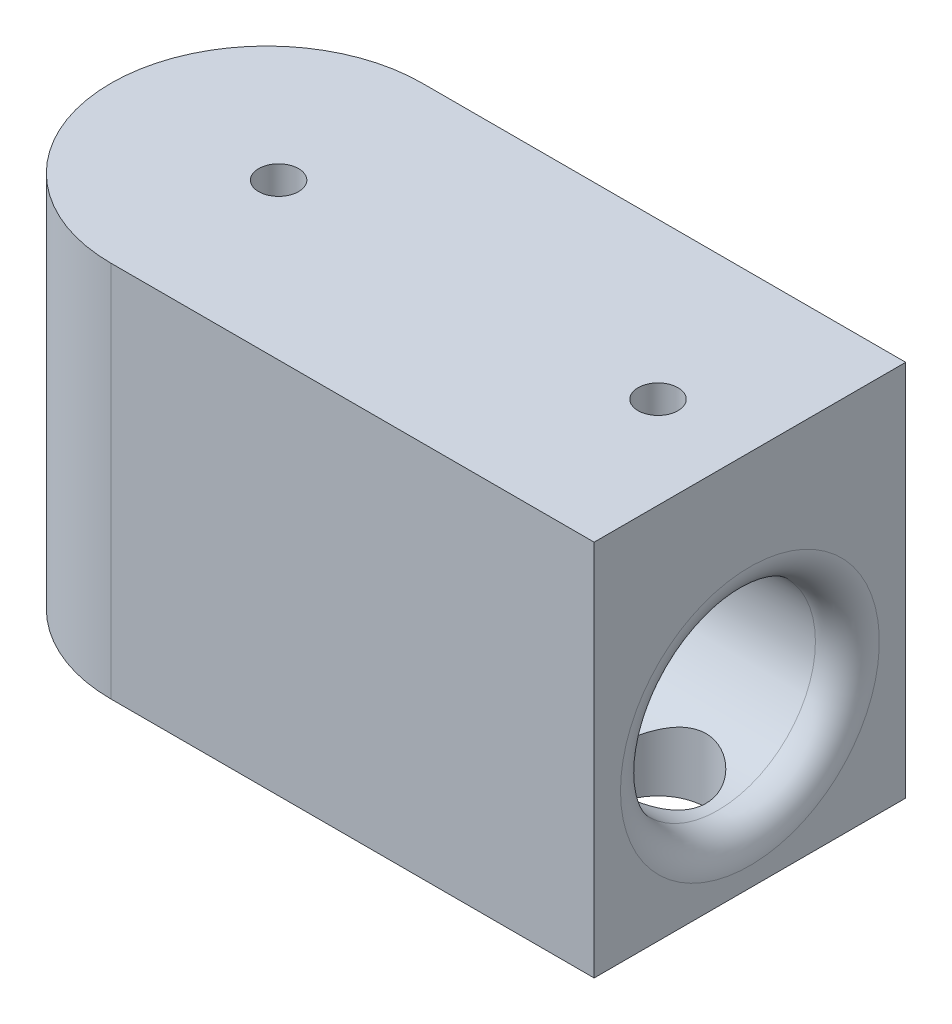
from build123d import *

# Parameters (mm, degrees)
SKETCH1_W           = 40
SKETCH1_H           = 19.5
BOSS_EXTRUDE1_DEPTH = 23.625
SKETCH2_R           = 6.1
CUT_EXTRUDE1_DEPTH  = 36.25
CUT_EXTRUDE2_REACH  = 49.46
SKETCH3_R           = 5
SKETCH5_R           = 3
CUT_EXTRUDE3_DEPTH  = 18
CUT_EXTRUDE4_REACH  = 50.003
SKETCH6_R           = 1.25
SKETCH7_R           = 1.25
CUT_EXTRUDE5_DEPTH  = 6.75
FILLET1_R           = 2
FILLET2_DEPTH       = 23.625


with BuildPart() as part:
    # Sketch1 → Boss-Extrude1 (new body)
    with BuildSketch(Plane(origin=(0, 0, 0), x_dir=(1, 0, 0), z_dir=(0, 1, 0))):
        with Locations((20, 9.75)):
            Rectangle(SKETCH1_W, SKETCH1_H)
    extrude(amount=BOSS_EXTRUDE1_DEPTH)

    # Sketch2 → Cut-Extrude1 (cut)
    with BuildSketch(Plane(origin=(40, 0, 0), x_dir=(0, 0, -1), z_dir=(1, 0, 0))):
        with Locations((9.75, 9.3125)):
            Circle(SKETCH2_R)
    extrude(amount=-CUT_EXTRUDE1_DEPTH, mode=Mode.SUBTRACT)

    # Sketch3 → Cut-Extrude2 (cut, up to next)
    with BuildSketch(Plane(origin=(3.75, 0, 0), x_dir=(0, 0, -1), z_dir=(1, 0, 0)), mode=Mode.PRIVATE) as cut_extrude2_sk1:
        with Locations((9.75, 9.3125)):
            Circle(SKETCH3_R)
    cut_extrude2_tool1 = extrude(cut_extrude2_sk1.sketch, amount=-CUT_EXTRUDE2_REACH, mode=Mode.PRIVATE) & part.part
    add(cut_extrude2_tool1.solids().sort_by_distance((3.75, 9.3125, -9.75))[0], mode=Mode.SUBTRACT)

    # Sketch5 → Cut-Extrude3 (cut)
    with BuildSketch(Plane.XZ):
        with Locations(Location((34.25, -9.75, 0), (0, 0, 270))):
            Circle(SKETCH5_R)
        with Locations(Location((10.5, -9.75, 0), (0, 0, 270))):
            Circle(SKETCH5_R)
    extrude(amount=-CUT_EXTRUDE3_DEPTH, mode=Mode.SUBTRACT)

    # Sketch6 → Cut-Extrude4 (cut, up to next)
    with BuildSketch(Plane.XZ.offset(-18), mode=Mode.PRIVATE) as cut_extrude4_sk1:
        with Locations(Location((10.5, -9.75, 0), (0, 0, 270))):
            Circle(SKETCH6_R)
    cut_extrude4_tool1 = extrude(cut_extrude4_sk1.sketch, amount=-CUT_EXTRUDE4_REACH, mode=Mode.PRIVATE) & part.part
    # Sketch6 → Cut-Extrude4 (cut, up to next)
    with BuildSketch(Plane.XZ.offset(-18), mode=Mode.PRIVATE) as cut_extrude4_sk2:
        with Locations(Location((34.25, -9.75, 0), (0, 0, 270))):
            Circle(SKETCH6_R)
    cut_extrude4_tool2 = extrude(cut_extrude4_sk2.sketch, amount=-CUT_EXTRUDE4_REACH, mode=Mode.PRIVATE) & part.part
    add(cut_extrude4_tool1.solids().sort_by_distance((10.5, 18, -9.75))[0], mode=Mode.SUBTRACT)
    add(cut_extrude4_tool2.solids().sort_by_distance((34.25, 18, -9.75))[0], mode=Mode.SUBTRACT)

    # Sketch7 → Cut-Extrude5 (cut)
    with BuildSketch(Plane.XZ):
        with Locations(Location((20, -3, 0), (0, 0, 270))):
            Circle(SKETCH7_R)
        with Locations(Location((20, -16.5, 0), (0, 0, 270))):
            Circle(SKETCH7_R)
    extrude(amount=-CUT_EXTRUDE5_DEPTH, mode=Mode.SUBTRACT)

    # Fillet1
    fillet1_edges = [part.edges().sort_by_distance(p)[0] for p in [
        (40, 9.3125, -3.65),
    ]]
    fillet(fillet1_edges, radius=FILLET1_R)

    # Fillet2: read off the stored shape, not the designer's step
    # Fillet2 outline → Fillet2 (cut)
    with BuildSketch(Plane(origin=(0, 0, 0), x_dir=(1, 0, 0), z_dir=(0, 1, 0))):
        with BuildLine():
            Line((0, 19.5), (0, 9.75))
            ThreePointArc((0, 9.75), (2.855708883, 16.644291117), (9.75, 19.5))
            Line((9.75, 19.5), (0, 19.5))
        make_face()
        with BuildLine():
            ThreePointArc((9.75, 0), (2.855708883, 2.855708883), (0, 9.75))
            Line((0, 9.75), (0, 0))
            Line((0, 0), (9.75, 0))
        make_face()
    extrude(amount=FILLET2_DEPTH, mode=Mode.SUBTRACT)


solid = part.part
